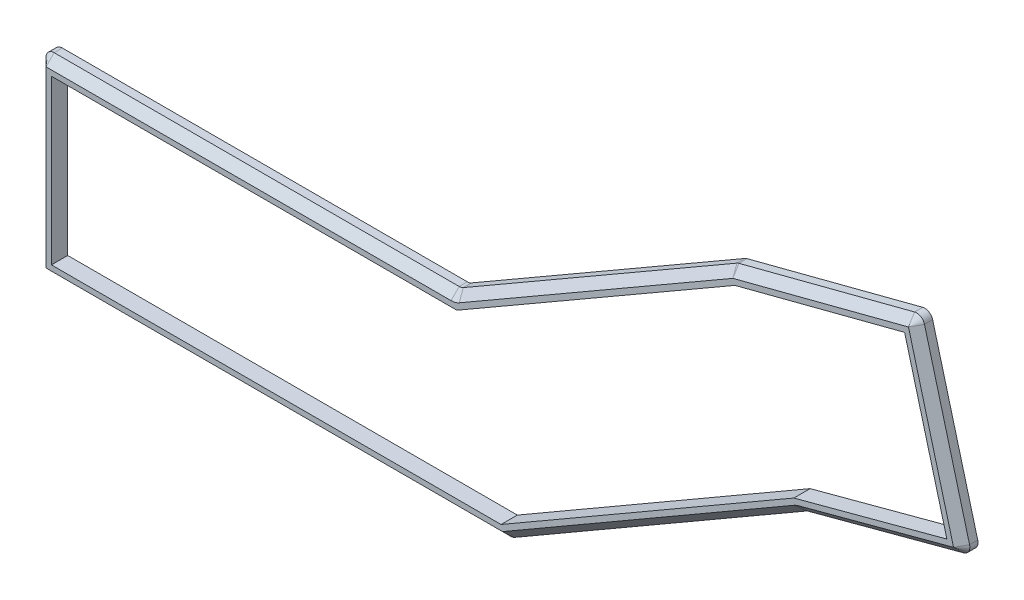
from build123d import *

# Parameters (mm, degrees)
BOSS_EXTRU_1_DEPTH      = 6
CONG_1_R                = 3
ESQUISSE2_R             = 1
ENL_V_MAT_EXTRU_1_DEPTH = 3
CHANFREIN1_SIZE         = 3


with BuildPart() as part:
    # Esquisse1 → Boss.-Extru.1 (new body)
    with BuildSketch(Plane.XY):
        Polygon((-26.464533767, 12.30154537), (75.33141454, 71.077500491), (143.246352653, 88.745859712), (161.383942986, 21.020985262), (100.854480283, 4.809102496), (-7.520422715, -57.858487698), (-179.373873722, -57.858487698), (-179.373873722, -50.687645053), (-179.373873722, 12.291034855), align=None)
        Polygon((-25.124548608, 7.301637465), (-174.373873722, 7.291378528), (-174.373873722, -50.687645053), (-174.373873722, -52.858487698), (-8.861972593, -52.858487698), (98.923133978, 9.468053786), (155.26069475, 24.557200291), (139.700811798, 82.657041562), (77.245358051, 66.408990356), align=None, mode=Mode.SUBTRACT)
    extrude(amount=BOSS_EXTRU_1_DEPTH)

    # Congé1
    cong_1_edges = [part.edges().sort_by_distance(p)[0] for p in [
        (75.33141454, 71.077500491, 3),
        (143.246352653, 88.745859712, 3),
        (161.383942986, 21.020985262, 3),
        (100.854480283, 4.809102496, 3),
        (-7.520422715, -57.858487698, 3),
        (-179.373873722, -57.858487698, 3),
        (-179.373873722, 12.291034855, 3),
        (-26.464533767, 12.30154537, 3),
    ]]
    fillet(cong_1_edges, radius=CONG_1_R)

    # Esquisse2 → Enlèv. mat.-Extru.1 (cut)
    with BuildSketch(Plane.XY):
        with Locations((158.201617013, 22.958080812)):
            Circle(ESQUISSE2_R)
        with Locations((141.388472611, 85.534334234)):
            Circle(ESQUISSE2_R)
        with Locations((76.500226548, 68.776582274)):
            Circle(ESQUISSE2_R)
        with Locations((99.890442316, 7.071415488)):
            Circle(ESQUISSE2_R)
        with Locations((-8.172352823, -55.275906246)):
            Circle(ESQUISSE2_R)
        with Locations((-25.691359515, 9.920090126)):
            Circle(ESQUISSE2_R)
        with Locations((-176.562127678, 9.920090126)):
            Circle(ESQUISSE2_R)
        with Locations((-177.029598341, -55.275906246)):
            Circle(ESQUISSE2_R)
    extrude(amount=ENL_V_MAT_EXTRU_1_DEPTH, mode=Mode.SUBTRACT)

    # Chanfrein1
    chanfrein1_edges = [part.edges().sort_by_distance(p)[0] for p in [
        (-92.349613182, -57.858487698, 6),
        (-179.373873722, -22.78362332, 6),
        (24.605627892, 41.788942262, 6),
        (-101.821199292, 12.296365586, 6),
        (46.843967712, -26.422377988, 6),
        (129.861641055, 12.578223, 6),
        (152.312387337, 54.893729991, 6),
        (108.044083383, 79.587840046, 6),
        (-178.495266971, 11.412488494, 6),
        (75.341794938, 71.05218052, 6),
        (142.628648998, 87.685066626, 6),
        (160.307894606, 21.642410085, 6),
        (-7.547920203, -57.756003669, 6),
        (-178.495194066, -56.979808041, 6),
        (100.86445313, 4.78504518, 6),
        (-26.491925042, 12.40375087, 6),
    ]]
    chamfer(chanfrein1_edges, length=CHANFREIN1_SIZE - 0.0001)  # a hair under: the kernel refuses the full size


solid = part.part
